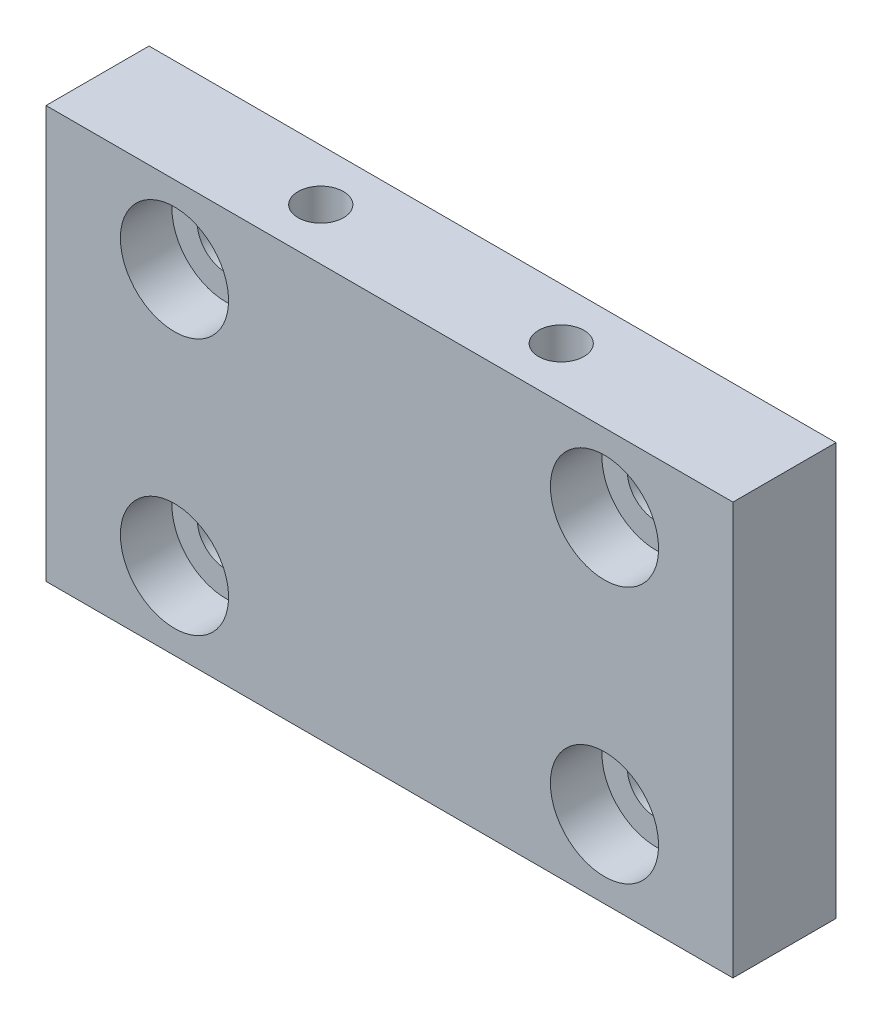
from build123d import *

# Parameters (mm, degrees)
SKETCH1_W               = 63.5
SKETCH1_H               = 38.1
SKETCH1_R               = 2.6543
BOSS_EXTRUDE1_DEPTH     = 9.525
CUT_EXTRUDE2_DEPTH      = 39.232062788
CUT_EXTRUDE2_DEPTH_BACK = 4.7625
SKETCH4_R               = 5
CUT_EXTRUDE3_DEPTH      = 39.232062788
CUT_EXTRUDE3_DEPTH_BACK = 39.232062788
SKETCH5_R               = 2.1


with BuildPart() as part:
    # Sketch1 → Boss-Extrude1 (new body)
    with BuildSketch(Plane.XY):
        Rectangle(SKETCH1_W, SKETCH1_H)
        with Locations((-19.875, 11.875)):
            Circle(SKETCH1_R, mode=Mode.SUBTRACT)
        with Locations((-19.875, -11.875)):
            Circle(SKETCH1_R, mode=Mode.SUBTRACT)
        with Locations((19.875, -11.875)):
            Circle(SKETCH1_R, mode=Mode.SUBTRACT)
        with Locations((19.875, 11.875)):
            Circle(SKETCH1_R, mode=Mode.SUBTRACT)
    extrude(amount=BOSS_EXTRUDE1_DEPTH)

    # Sketch4 → Cut-Extrude2 (cut, two sides: drawn at the far end of the back side and taken through both)
    with BuildSketch(Plane.XY.offset(9.525).offset(-CUT_EXTRUDE2_DEPTH_BACK)):
        with Locations((19.875, -11.875)):
            Circle(SKETCH4_R)
        with Locations((19.875, 11.875)):
            Circle(SKETCH4_R)
        with Locations((-19.875, 11.875)):
            Circle(SKETCH4_R)
        with Locations((-19.875, -11.875)):
            Circle(SKETCH4_R)
    extrude(amount=CUT_EXTRUDE2_DEPTH + CUT_EXTRUDE2_DEPTH_BACK, mode=Mode.SUBTRACT)

    # Sketch5 → Cut-Extrude3 (cut, two sides: drawn at the far end of the back side and taken through both)
    with BuildSketch(Plane(origin=(0, 0, 0), x_dir=(1, 0, 0), z_dir=(0, 1, 0)).offset(-CUT_EXTRUDE3_DEPTH_BACK)):
        with Locations((-11.1125, -4.7625)):
            Circle(SKETCH5_R)
        with Locations((11.1125, -4.7625)):
            Circle(SKETCH5_R)
    extrude(amount=CUT_EXTRUDE3_DEPTH + CUT_EXTRUDE3_DEPTH_BACK, mode=Mode.SUBTRACT)


solid = part.part
